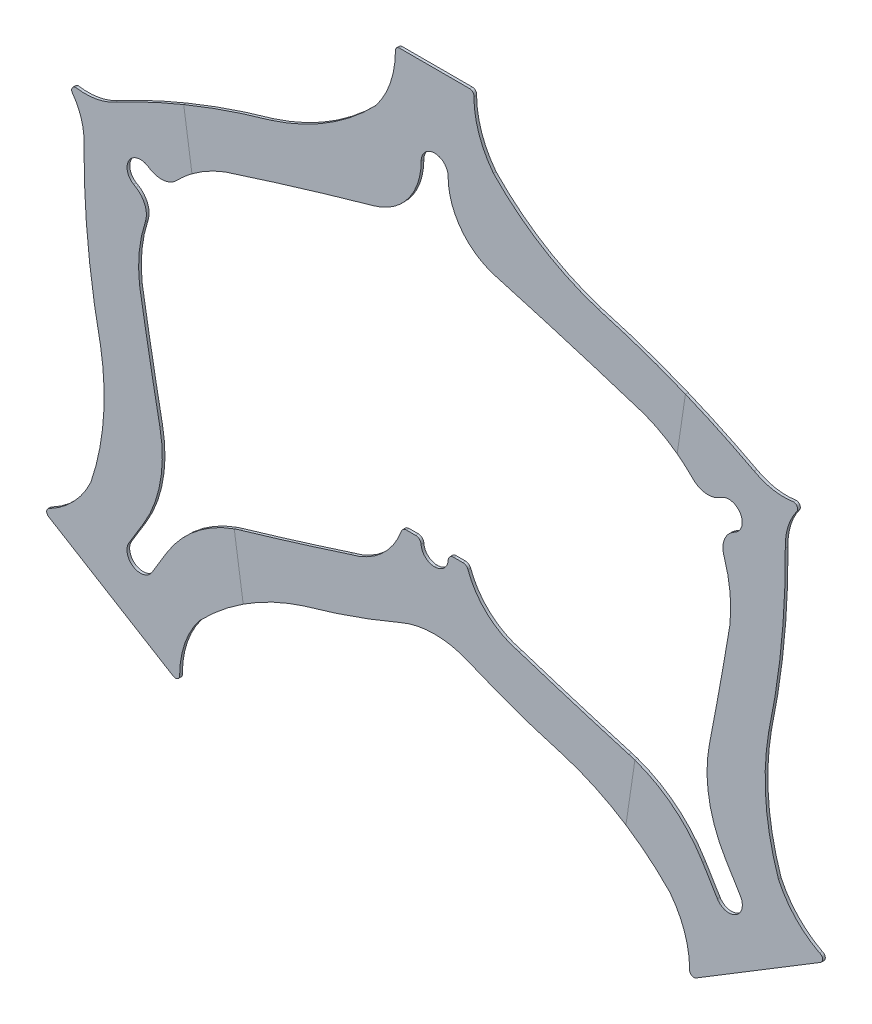
from build123d import *

# Parameters (mm, degrees)
BOSS_EXTRUDE1_DEPTH = 6.35
SPLIT1_START        = -921.558258203
SPLIT1_OUTLINE_W    = 1522
SPLIT1_OUTLINE_H    = 6.35
SPLIT1_DEPTH        = 1416.565370323
SPLIT1_2_DEPTH      = 6.35
SPLIT1_3_DEPTH      = 6.35
SPLIT1_4_DEPTH      = 6.35
SPLIT1_5_DEPTH      = 6.35


# Read off the part's stored shape, not the designer's step: Split1
with BuildPart() as part:
    # Model → Boss-Extrude1 (new body)
    with BuildSketch(Plane.XY):
        with BuildLine():
            Line((-762.773108422, -473.790460288), (-909.585552113, -384.529407593))
            ThreePointArc((-909.585552113, -384.529407593), (-914.31670739, -374.706652227), (-907.272518097, -366.385008734))
            ThreePointArc((-907.272518097, -366.385008734), (-850.308831191, -323.227457845), (-810.194701222, -264.081093617))
            ThreePointArc((-810.194701222, -264.081093617), (-780.663906243, -120.357541789), (-787.492762656, 26.20948698))
            ThreePointArc((-787.492762656, 26.20948698), (-817.499220197, 221.88381941), (-826.344983883, 419.647780563))
            ThreePointArc((-826.344983883, 419.647780563), (-832.869024321, 467.190363127), (-854.6460748, 509.952733652))
            ThreePointArc((-854.6460748, 509.952733652), (-855.512589438, 514.682963729), (-854.074040107, 519.271699942))
            ThreePointArc((-854.074040107, 519.271699942), (-850.662187529, 522.660680052), (-846.063879013, 524.068331638))
            ThreePointArc((-846.063879013, 524.068331638), (-798.077002564, 524.414668473), (-752.865974281, 540.502651011))
            ThreePointArc((-752.865974281, 540.502651011), (-573.219180868, 623.664309735), (-385.688991062, 687.0777135))
            ThreePointArc((-385.688991062, 687.0777135), (-275.476525045, 734.848922987), (-177.216508281, 803.941941643))
            ThreePointArc((-177.216508281, 803.941941643), (-157.397592959, 821.945955082), (-138.415510553, 840.830193271))
            ThreePointArc((-138.415510553, 840.830193271), (-104.366417411, 903.664062171), (-92.266776022, 974.098673711))
            ThreePointArc((-92.266776022, 974.098673711), (-90.131254254, 982.340537848), (-82.424865051, 985.959977462))
            Line((-82.424865051, 985.959977462), (0.226267484, 985.959977462))
            Line((0.226267484, 985.959977462), (82.877400019, 985.959977462))
            ThreePointArc((82.877400019, 985.959977462), (90.583789223, 982.340537848), (92.71931099, 974.098673711))
            ThreePointArc((92.71931099, 974.098673711), (104.81895238, 903.664062171), (138.868045521, 840.830193271))
            ThreePointArc((138.868045521, 840.830193271), (157.850127927, 821.945955082), (177.669043249, 803.941941643))
            ThreePointArc((177.669043249, 803.941941643), (275.929060013, 734.848922987), (386.141526031, 687.0777135))
            ThreePointArc((386.141526031, 687.0777135), (573.671715837, 623.664309735), (753.318509252, 540.502651009))
            ThreePointArc((753.318509252, 540.502651009), (798.529537534, 524.414668473), (846.516413982, 524.068331638))
            ThreePointArc((846.516413982, 524.068331638), (851.114722498, 522.660680052), (854.526575076, 519.271699942))
            ThreePointArc((854.526575076, 519.271699942), (855.965124406, 514.682963729), (855.098609768, 509.952733652))
            ThreePointArc((855.098609768, 509.952733652), (833.321559289, 467.190363127), (826.797518851, 419.647780563))
            ThreePointArc((826.797518851, 419.647780563), (817.951755166, 221.88381941), (787.945297625, 26.20948698))
            ThreePointArc((787.945297625, 26.20948698), (781.116441212, -120.357541789), (810.64723619, -264.081093617))
            ThreePointArc((810.64723619, -264.081093617), (850.76136616, -323.227457845), (907.725053065, -366.385008734))
            ThreePointArc((907.725053065, -366.385008734), (914.769242359, -374.706652227), (910.038087081, -384.529407593))
            Line((910.038087081, -384.529407593), (763.225643391, -473.790460288))
            Line((763.225643391, -473.790460288), (616.4131997, -563.051512983))
            ThreePointArc((616.4131997, -563.051512983), (605.515137085, -562.731224894), (601.369020257, -552.647571365))
            ThreePointArc((601.369020257, -552.647571365), (589.269378868, -482.212959825), (555.220285726, -419.379090926))
            ThreePointArc((555.220285726, -419.379090926), (536.23820332, -400.494852736), (516.419287998, -382.490839297))
            ThreePointArc((516.419287998, -382.490839297), (418.159271237, -313.397820643), (307.946805223, -265.626611157))
            ThreePointArc((307.946805223, -265.626611157), (192.3034735, -229.187931775), (79.306354393, -185.224212632))
            ThreePointArc((79.306354393, -185.224212632), (40.586647264, -173.140215935), (0.226267484, -169.105561011))
            ThreePointArc((0.226267484, -169.105561011), (-40.134112296, -173.140215935), (-78.853819425, -185.224212632))
            ThreePointArc((-78.853819425, -185.224212632), (-191.85093853, -229.187931774), (-307.494270251, -265.626611156))
            ThreePointArc((-307.494270251, -265.626611156), (-417.706736267, -313.397820642), (-515.96675303, -382.490839297))
            ThreePointArc((-515.96675303, -382.490839297), (-535.785668351, -400.494852736), (-554.767750757, -419.379090926))
            ThreePointArc((-554.767750757, -419.379090926), (-588.816843899, -482.212959825), (-600.916485289, -552.647571365))
            ThreePointArc((-600.916485289, -552.647571365), (-605.062602116, -562.731224894), (-615.960664732, -563.051512983))
            Line((-615.960664732, -563.051512983), (-762.773108422, -473.790460288))
        make_face()
        with BuildLine():
            Line((-720.538786319, -343.210038527), (-686.219035502, -286.76250254))
            ThreePointArc((-686.219035502, -286.76250254), (-646.598833638, -181.954766519), (-647.527286885, -69.912096522))
            ThreePointArc((-647.527286885, -69.912096522), (-672.545695217, 63.092761809), (-695.643154418, 196.444628963))
            ThreePointArc((-695.643154418, 196.444628963), (-696.148974183, 264.662586858), (-681.911908037, 331.380287512))
            ThreePointArc((-681.911908037, 331.380287512), (-682.475508458, 364.864500994), (-703.756895391, 390.722048598))
            Line((-703.756895391, 390.722048598), (-709.677681467, 394.321849709))
            ThreePointArc((-709.677681467, 394.321849709), (-720.312519141, 437.945527084), (-676.688841766, 448.580364758))
            Line((-676.688841766, 448.580364758), (-670.768055691, 444.980563647))
            ThreePointArc((-670.768055691, 444.980563647), (-638.017476576, 437.987011935), (-608.030650775, 452.896756275))
            ThreePointArc((-608.030650775, 452.896756275), (-555.350541254, 496.241325646), (-494.553522216, 527.187538809))
            ThreePointArc((-494.553522216, 527.187538809), (-319.087978309, 582.264228798), (-142.576700401, 633.891427538))
            ThreePointArc((-142.576700401, 633.891427538), (-62.418490472, 688.584970123), (-31.523732534, 780.57538349))
            Line((-31.523732534, 780.57538349), (-31.523732534, 781.155560723))
            ThreePointArc((-31.523732534, 781.155560723), (-22.224372837, 803.606201026), (0.226267466, 812.905560723))
            ThreePointArc((0.226267466, 812.905560723), (22.676907769, 803.606201026), (31.976267466, 781.155560723))
            Line((31.976267466, 781.155560723), (31.976267466, 780.57538349))
            ThreePointArc((31.976267466, 780.57538349), (62.871025404, 688.584970123), (143.029235333, 633.891427538))
            ThreePointArc((143.029235333, 633.891427538), (319.540513241, 582.264228798), (495.006057148, 527.187538809))
            ThreePointArc((495.006057148, 527.187538809), (555.803076186, 496.241325646), (608.483185707, 452.896756275))
            ThreePointArc((608.483185707, 452.896756275), (638.470011508, 437.987011935), (671.220590623, 444.980563647))
            Line((671.220590623, 444.980563647), (677.141376698, 448.580364758))
            ThreePointArc((677.141376698, 448.580364758), (720.765054073, 437.945527084), (710.130216399, 394.321849709))
            Line((710.130216399, 394.321849709), (704.209430322, 390.722048598))
            ThreePointArc((704.209430322, 390.722048598), (682.92804339, 364.864500994), (682.364442969, 331.380287512))
            ThreePointArc((682.364442969, 331.380287512), (696.601509115, 264.662586858), (696.09568935, 196.444628963))
            ThreePointArc((696.09568935, 196.444628963), (672.998230158, 63.092761813), (647.979821836, -69.912096513))
            ThreePointArc((647.979821836, -69.912096513), (647.051368587, -181.954766515), (686.671570451, -286.76250254))
            Line((686.671570451, -286.76250254), (720.991321269, -343.210038527))
            ThreePointArc((720.991321269, -343.210038527), (710.356483595, -386.833715902), (666.73280622, -376.198878228))
            Line((666.73280622, -376.198878228), (632.413055402, -319.75134224))
            ThreePointArc((632.413055402, -319.75134224), (557.598261445, -236.34169932), (457.698948107, -185.601684325))
            ThreePointArc((457.698948107, -185.601684325), (328.102619336, -146.60162456), (199.082274062, -105.736436464))
            ThreePointArc((199.082274062, -105.736436464), (125.382593656, -67.117276728), (78.752955877, 1.793965252))
            ThreePointArc((78.752955877, 1.793965252), (74.103964482, 7.860122242), (66.81541577, 10.159782934))
            Line((66.81541577, 10.159782934), (44.829891758, 10.159782934))
            ThreePointArc((44.829891758, 10.159782934), (36.110010491, 6.693074367), (32.150646876, -1.814442154))
            ThreePointArc((32.150646876, -1.814442154), (22.169722517, -23.160882493), (0.225925346, -31.749196175))
            ThreePointArc((0.225925346, -31.749196175), (-21.717435544, -23.160645358), (-31.698111926, -1.814442154))
            ThreePointArc((-31.698111926, -1.814442154), (-35.657475541, 6.693074367), (-44.377356808, 10.159782934))
            Line((-44.377356808, 10.159782934), (-66.36288082, 10.159782934))
            ThreePointArc((-66.36288082, 10.159782934), (-73.651429531, 7.860122242), (-78.300420926, 1.793965252))
            ThreePointArc((-78.300420926, 1.793965252), (-124.930058706, -67.117276728), (-198.629739112, -105.736436464))
            ThreePointArc((-198.629739112, -105.736436464), (-327.650084393, -146.601624563), (-457.246413173, -185.601684329))
            ThreePointArc((-457.246413173, -185.601684329), (-557.145726501, -236.341699325), (-631.960520452, -319.751342239))
            Line((-631.960520452, -319.751342239), (-666.28027127, -376.198878228))
            ThreePointArc((-666.28027127, -376.198878228), (-709.903948645, -386.833715902), (-720.538786319, -343.210038527))
        make_face(mode=Mode.SUBTRACT)
    extrude(amount=BOSS_EXTRUDE1_DEPTH)

    # Split1 outline → Split1 (cut)
    with BuildSketch(Plane(origin=(0, 0, 0), x_dir=(0.14608423021884007, 0.9892721555170594, 0), z_dir=(0.9892721555170595, -0.14608423021884007, 0)).offset(SPLIT1_START)):
        with Locations((154, 3.175)):
            Rectangle(SPLIT1_OUTLINE_W, SPLIT1_OUTLINE_H)
    extrude(amount=SPLIT1_DEPTH, mode=Mode.SUBTRACT)

    # Split1 2 outline → Split1 2 (cut)
    with BuildSketch(Plane.XY):
        with BuildLine():
            ThreePointArc((-78.853819425, -185.224212632), (-40.134112296, -173.140215935), (0.226267484, -169.105561011))
            ThreePointArc((0.226267484, -169.105561011), (40.586647264, -173.140215935), (79.306354393, -185.224212632))
            ThreePointArc((79.306354393, -185.224212632), (192.303473499, -229.187931775), (307.946805223, -265.626611157))
            ThreePointArc((307.946805223, -265.626611157), (381.830878211, -294.655699486), (451.151920246, -333.335634099))
            Line((451.151920246, -333.335634099), (472.277440645, -190.275092452))
            ThreePointArc((472.277440645, -190.275092452), (465.017540532, -187.846844338), (457.698948107, -185.601684325))
            ThreePointArc((457.698948107, -185.601684325), (328.102619336, -146.60162456), (199.082274062, -105.736436464))
            ThreePointArc((199.082274062, -105.736436464), (125.382593656, -67.117276728), (78.752955877, 1.793965252))
            ThreePointArc((78.752955877, 1.793965252), (74.103964482, 7.860122242), (66.81541577, 10.159782934))
            Line((66.81541577, 10.159782934), (44.829891758, 10.159782934))
            ThreePointArc((44.829891758, 10.159782934), (36.110010491, 6.693074367), (32.150646876, -1.814442154))
            ThreePointArc((32.150646876, -1.814442154), (22.169722517, -23.160882493), (0.225925346, -31.749196175))
            ThreePointArc((0.225925346, -31.749196175), (-21.717435544, -23.160645358), (-31.698111926, -1.814442154))
            ThreePointArc((-31.698111926, -1.814442154), (-35.657475541, 6.693074367), (-44.377356808, 10.159782934))
            Line((-44.377356808, 10.159782934), (-66.36288082, 10.159782934))
            ThreePointArc((-66.36288082, 10.159782934), (-73.651429531, 7.860122242), (-78.300420926, 1.793965252))
            ThreePointArc((-78.300420926, 1.793965252), (-124.930058706, -67.117276728), (-198.629739112, -105.736436464))
            ThreePointArc((-198.629739112, -105.736436464), (-327.650084393, -146.601624563), (-457.246413173, -185.601684329))
            ThreePointArc((-457.246413173, -185.601684329), (-557.145726501, -236.341699325), (-631.960520452, -319.751342239))
            Line((-631.960520452, -319.751342239), (-666.28027127, -376.198878228))
            ThreePointArc((-666.28027127, -376.198878228), (-709.903948645, -386.833715902), (-720.538786319, -343.210038527))
            Line((-720.538786319, -343.210038527), (-686.219035502, -286.76250254))
            ThreePointArc((-686.219035502, -286.76250254), (-646.598833638, -181.954766519), (-647.527286885, -69.912096522))
            ThreePointArc((-647.527286885, -69.912096522), (-672.545695217, 63.092761809), (-695.643154418, 196.444628963))
            ThreePointArc((-695.643154418, 196.444628963), (-696.148974183, 264.662586858), (-681.911908037, 331.380287512))
            ThreePointArc((-681.911908037, 331.380287512), (-682.475508458, 364.864500994), (-703.756895391, 390.722048598))
            Line((-703.756895391, 390.722048598), (-709.677681467, 394.321849709))
            ThreePointArc((-709.677681467, 394.321849709), (-720.312519141, 437.945527084), (-676.688841766, 448.580364758))
            Line((-676.688841766, 448.580364758), (-670.768055691, 444.980563647))
            ThreePointArc((-670.768055691, 444.980563647), (-638.017476576, 437.987011935), (-608.030650775, 452.896756275))
            ThreePointArc((-608.030650775, 452.896756275), (-555.350541254, 496.241325646), (-494.553522216, 527.187538809))
            ThreePointArc((-494.553522216, 527.187538809), (-319.087978309, 582.264228798), (-142.576700401, 633.891427538))
            ThreePointArc((-142.576700401, 633.891427538), (-62.418490472, 688.584970123), (-31.523732534, 780.57538349))
            Line((-31.523732534, 780.57538349), (-31.523732534, 781.155560723))
            ThreePointArc((-31.523732534, 781.155560723), (0.226267466, 812.905560723), (31.976267466, 781.155560723))
            Line((31.976267466, 781.155560723), (31.976267466, 780.57538349))
            ThreePointArc((31.976267466, 780.57538349), (62.871025404, 688.584970123), (143.029235333, 633.891427538))
            ThreePointArc((143.029235333, 633.891427538), (319.540513241, 582.264228798), (495.006057148, 527.187538809))
            ThreePointArc((495.006057148, 527.187538809), (534.97852265, 508.751613183), (571.980617219, 484.907822596))
            Line((571.980617219, 484.907822596), (591.409169958, 616.476618334))
            ThreePointArc((591.409169958, 616.476618334), (489.815682169, 654.801863258), (386.141526031, 687.0777135))
            ThreePointArc((386.141526031, 687.0777135), (252.875836477, 748.46812961), (138.868045521, 840.830193271))
            ThreePointArc((138.868045521, 840.830193271), (104.81895238, 903.664062171), (92.71931099, 974.098673711))
            ThreePointArc((92.71931099, 974.098673711), (90.583789223, 982.340537848), (82.877400019, 985.959977462))
            Line((82.877400019, 985.959977462), (-82.424865051, 985.959977462))
            ThreePointArc((-82.424865051, 985.959977462), (-90.131254254, 982.340537848), (-92.266776022, 974.098673711))
            ThreePointArc((-92.266776022, 974.098673711), (-104.366417411, 903.66406217), (-138.415510553, 840.830193271))
            ThreePointArc((-138.415510553, 840.830193271), (-252.423301509, 748.46812961), (-385.688991062, 687.0777135))
            ThreePointArc((-385.688991062, 687.0777135), (-573.219180867, 623.664309735), (-752.865974281, 540.502651011))
            ThreePointArc((-752.865974281, 540.502651011), (-798.077002564, 524.414668473), (-846.063879013, 524.068331638))
            ThreePointArc((-846.063879013, 524.068331638), (-854.074040107, 519.271699941), (-854.6460748, 509.952733652))
            ThreePointArc((-854.6460748, 509.952733652), (-832.869024321, 467.190363127), (-826.344983883, 419.647780563))
            ThreePointArc((-826.344983883, 419.647780563), (-817.499220197, 221.88381941), (-787.492762656, 26.20948698))
            ThreePointArc((-787.492762656, 26.20948698), (-780.663906243, -120.357541789), (-810.194701222, -264.081093617))
            ThreePointArc((-810.194701222, -264.081093617), (-850.308831191, -323.227457845), (-907.272518097, -366.385008734))
            ThreePointArc((-907.272518097, -366.385008734), (-914.31670739, -374.706652227), (-909.585552113, -384.529407593))
            Line((-909.585552113, -384.529407593), (-615.960664732, -563.051512983))
            ThreePointArc((-615.960664732, -563.051512983), (-605.062602116, -562.731224894), (-600.916485289, -552.647571365))
            ThreePointArc((-600.916485289, -552.647571365), (-588.816843899, -482.212959825), (-554.767750757, -419.379090926))
            ThreePointArc((-554.767750757, -419.379090926), (-440.759959803, -327.017027265), (-307.494270251, -265.626611156))
            ThreePointArc((-307.494270251, -265.626611156), (-191.85093853, -229.187931774), (-78.853819425, -185.224212632))
        make_face()
    extrude(amount=SPLIT1_2_DEPTH, mode=Mode.SUBTRACT)


with BuildPart() as body_2:
    # Split1 3 outline → Split1 3 (new body)
    with BuildSketch(Plane.XY):
        with BuildLine():
            ThreePointArc((-457.246413173, -185.601684329), (-464.782019349, -187.916501641), (-472.255241426, -190.425424005))
            Line((-472.255241426, -190.425424005), (-451.112265588, -333.604172663))
            ThreePointArc((-451.112265588, -333.604172663), (-381.600954161, -294.761009307), (-307.494270251, -265.626611156))
            ThreePointArc((-307.494270251, -265.626611156), (-191.85093853, -229.187931774), (-78.853819425, -185.224212632))
            ThreePointArc((-78.853819425, -185.224212632), (-40.134112296, -173.140215935), (0.226267484, -169.105561011))
            ThreePointArc((0.226267484, -169.105561011), (40.586647264, -173.140215935), (79.306354393, -185.224212632))
            ThreePointArc((79.306354393, -185.224212632), (192.303473499, -229.187931775), (307.946805223, -265.626611157))
            ThreePointArc((307.946805223, -265.626611157), (381.830878211, -294.655699486), (451.151920246, -333.335634099))
            Line((451.151920246, -333.335634099), (472.277440645, -190.275092452))
            ThreePointArc((472.277440645, -190.275092452), (465.017540532, -187.846844337), (457.698948107, -185.601684325))
            ThreePointArc((457.698948107, -185.601684325), (328.102619336, -146.60162456), (199.082274062, -105.736436464))
            ThreePointArc((199.082274062, -105.736436464), (125.382593656, -67.117276728), (78.752955877, 1.793965252))
            ThreePointArc((78.752955877, 1.793965252), (74.103964482, 7.860122242), (66.81541577, 10.159782934))
            Line((66.81541577, 10.159782934), (44.829891758, 10.159782934))
            ThreePointArc((44.829891758, 10.159782934), (36.110010491, 6.693074367), (32.150646876, -1.814442154))
            ThreePointArc((32.150646876, -1.814442154), (22.169722517, -23.160882493), (0.225925346, -31.749196175))
            ThreePointArc((0.225925346, -31.749196175), (-21.717435544, -23.160645358), (-31.698111926, -1.814442154))
            ThreePointArc((-31.698111926, -1.814442154), (-35.657475541, 6.693074367), (-44.377356808, 10.159782934))
            Line((-44.377356808, 10.159782934), (-66.36288082, 10.159782934))
            ThreePointArc((-66.36288082, 10.159782934), (-73.651429531, 7.860122242), (-78.300420926, 1.793965252))
            ThreePointArc((-78.300420926, 1.793965252), (-124.930058706, -67.117276728), (-198.629739112, -105.736436464))
            ThreePointArc((-198.629739112, -105.736436464), (-327.650084393, -146.601624563), (-457.246413173, -185.601684329))
        make_face()
    extrude(amount=SPLIT1_3_DEPTH)


with BuildPart() as body_3:
    # Split1 4 outline → Split1 4 (new body)
    with BuildSketch(Plane.XY):
        with BuildLine():
            Line((-571.935506563, 484.602336399), (-591.38325078, 616.301095482))
            ThreePointArc((-591.38325078, 616.301095482), (-673.042234796, 580.356796511), (-752.865974281, 540.502651011))
            ThreePointArc((-752.865974281, 540.502651011), (-798.077002564, 524.414668473), (-846.063879013, 524.068331638))
            ThreePointArc((-846.063879013, 524.068331638), (-854.074040107, 519.271699941), (-854.6460748, 509.952733652))
            ThreePointArc((-854.6460748, 509.952733652), (-832.869024321, 467.190363127), (-826.344983883, 419.647780563))
            ThreePointArc((-826.344983883, 419.647780563), (-817.499220197, 221.88381941), (-787.492762656, 26.20948698))
            ThreePointArc((-787.492762656, 26.20948698), (-780.663906243, -120.357541789), (-810.194701222, -264.081093617))
            ThreePointArc((-810.194701222, -264.081093617), (-850.308831191, -323.227457845), (-907.272518097, -366.385008734))
            ThreePointArc((-907.272518097, -366.385008734), (-914.31670739, -374.706652227), (-909.585552113, -384.529407593))
            Line((-909.585552113, -384.529407593), (-615.960664732, -563.051512983))
            ThreePointArc((-615.960664732, -563.051512983), (-605.062602116, -562.731224894), (-600.916485289, -552.647571365))
            ThreePointArc((-600.916485289, -552.647571365), (-588.816843899, -482.212959825), (-554.767750757, -419.379090926))
            ThreePointArc((-554.767750757, -419.379090926), (-505.391765929, -373.52878269), (-451.112265588, -333.604172663))
            Line((-451.112265588, -333.604172663), (-472.255241426, -190.425424005))
            ThreePointArc((-472.255241426, -190.425424005), (-563.335727, -241.223055023), (-631.960520452, -319.751342239))
            Line((-631.960520452, -319.751342239), (-666.28027127, -376.198878228))
            ThreePointArc((-666.28027127, -376.198878228), (-709.903948645, -386.833715902), (-720.538786319, -343.210038527))
            Line((-720.538786319, -343.210038527), (-686.219035502, -286.76250254))
            ThreePointArc((-686.219035502, -286.76250254), (-646.598833638, -181.954766519), (-647.527286885, -69.912096522))
            ThreePointArc((-647.527286885, -69.912096522), (-672.545695217, 63.092761809), (-695.643154418, 196.444628963))
            ThreePointArc((-695.643154418, 196.444628963), (-696.148974183, 264.662586858), (-681.911908037, 331.380287512))
            ThreePointArc((-681.911908037, 331.380287512), (-682.475508458, 364.864500994), (-703.756895391, 390.722048598))
            Line((-703.756895391, 390.722048598), (-709.677681467, 394.321849709))
            ThreePointArc((-709.677681467, 394.321849709), (-720.312519141, 437.945527084), (-676.688841766, 448.580364758))
            Line((-676.688841766, 448.580364758), (-670.768055691, 444.980563647))
            ThreePointArc((-670.768055691, 444.980563647), (-638.017476576, 437.987011935), (-608.030650775, 452.896756275))
            ThreePointArc((-608.030650775, 452.896756275), (-590.590245754, 469.440774297), (-571.935506563, 484.602336399))
        make_face()
    extrude(amount=SPLIT1_4_DEPTH)


with BuildPart() as body_4:
    # Split1 5 outline → Split1 5 (new body)
    with BuildSketch(Plane.XY):
        with BuildLine():
            ThreePointArc((-385.688991062, 687.0777135), (-489.58125789, 654.726829578), (-591.38325078, 616.301095482))
            Line((-591.38325078, 616.301095482), (-571.935506563, 484.602336399))
            ThreePointArc((-571.935506563, 484.602336399), (-534.749105122, 508.628944018), (-494.553522216, 527.187538809))
            ThreePointArc((-494.553522216, 527.187538809), (-319.087978309, 582.264228798), (-142.576700401, 633.891427538))
            ThreePointArc((-142.576700401, 633.891427538), (-62.418490472, 688.584970123), (-31.523732534, 780.57538349))
            Line((-31.523732534, 780.57538349), (-31.523732534, 781.155560723))
            ThreePointArc((-31.523732534, 781.155560723), (0.226267466, 812.905560723), (31.976267466, 781.155560723))
            Line((31.976267466, 781.155560723), (31.976267466, 780.57538349))
            ThreePointArc((31.976267466, 780.57538349), (62.871025404, 688.584970123), (143.029235333, 633.891427538))
            ThreePointArc((143.029235333, 633.891427538), (319.540513241, 582.264228798), (495.006057148, 527.187538809))
            ThreePointArc((495.006057148, 527.187538809), (534.97852265, 508.751613182), (571.980617219, 484.907822596))
            Line((571.980617219, 484.907822596), (591.409169958, 616.476618334))
            ThreePointArc((591.409169958, 616.476618334), (489.815682169, 654.801863258), (386.141526031, 687.0777135))
            ThreePointArc((386.141526031, 687.0777135), (252.875836477, 748.46812961), (138.868045521, 840.830193271))
            ThreePointArc((138.868045521, 840.830193271), (104.81895238, 903.664062171), (92.71931099, 974.098673711))
            ThreePointArc((92.71931099, 974.098673711), (90.583789223, 982.340537848), (82.877400019, 985.959977462))
            Line((82.877400019, 985.959977462), (-82.424865051, 985.959977462))
            ThreePointArc((-82.424865051, 985.959977462), (-90.131254254, 982.340537848), (-92.266776022, 974.098673711))
            ThreePointArc((-92.266776022, 974.098673711), (-104.366417411, 903.66406217), (-138.415510553, 840.830193271))
            ThreePointArc((-138.415510553, 840.830193271), (-252.423301509, 748.46812961), (-385.688991062, 687.0777135))
        make_face()
    extrude(amount=SPLIT1_5_DEPTH)


solid = Compound([part.part, body_2.part, body_3.part, body_4.part])
